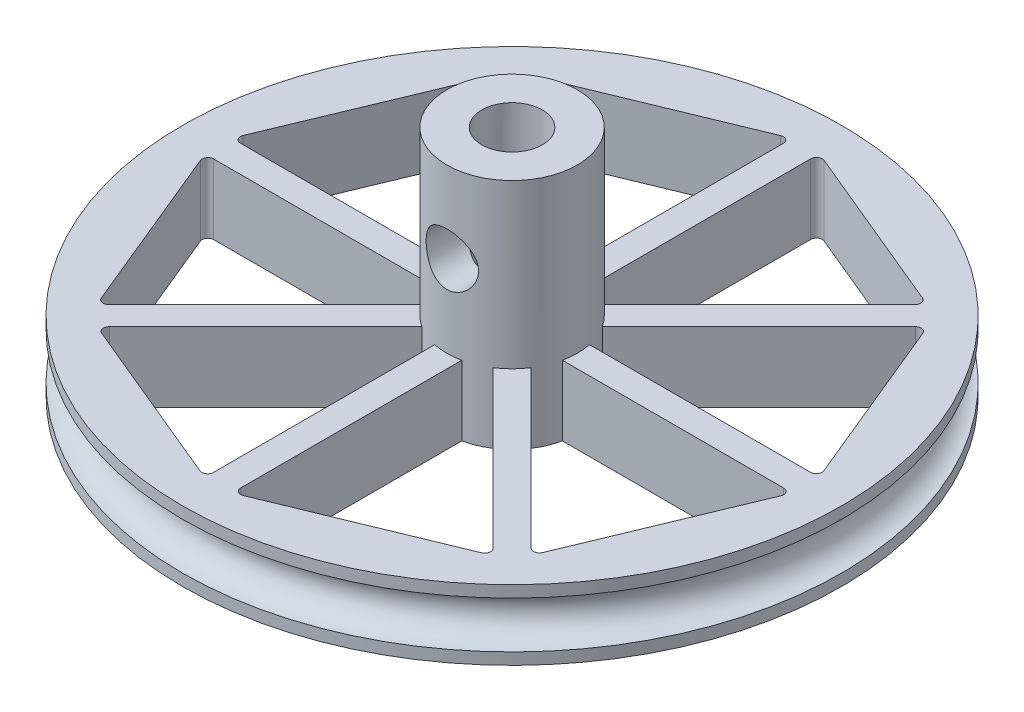
from build123d import *

# Parameters (mm, degrees)
ENL_V_START             = -5.600001354
ENL_V_MAT_EXTRU_1_DEPTH = 11.200001454
ENL_V_MAT_EXTRU_3_DEPTH = 6


# Read off the part's stored shape, not the designer's step: Enlèv. mat.-Extru.1
with BuildPart() as part:
    # Esquisse1 → Révolution1 (revolve)
    with BuildSketch(Plane(origin=(0, 0, 0), x_dir=(0, 0, -1), z_dir=(1, 0, 0)), mode=Mode.PRIVATE) as r_volution1_sk:
        with BuildLine():
            Line((5.6, 0), (28.3, 0))
            Line((28.3, 0), (28.3, -1))
            ThreePointArc((28.3, -1), (26.3, -3), (28.3, -5))
            Line((28.3, -5), (28.3, -6))
            Line((28.3, -6), (2.6, -6))
            Line((2.6, -6), (2.6, 0))
            Line((2.6, 0), (2.6, 14))
            Line((2.6, 14), (5.6, 14))
            Line((5.6, 14), (5.6, 0))
        make_face()
    revolve(r_volution1_sk.sketch.rotate(Axis((0, 0, 0), (0, -1, 0)), 180), axis=Axis((0, 0, 0), (0, -1, 0)))

    # Enlèv. mat.-Extru.1 outline → Enlèv. mat.-Extru.1 (cut)
    with BuildSketch(Plane.XY.offset(ENL_V_START)):
        with BuildLine():
            add(Edge.make_bspline(
                [(0, 4.75), (0.6013076, 4.75), (1.181365788, 4.999070592), (2.001835342, 5.820169976), (2.249317955, 6.403361701), (2.250679092, 7.591483004), (2.003145141, 8.178489261), (1.180171672, 9.002154395), (0.594632574, 9.249370285), (-0.589857498, 9.250627181), (-1.17573609, 9.006205165), (-2.00609398, 8.175925788), (-2.249601609, 7.594858131), (-2.250397379, 6.408159453), (-2.004861685, 5.823479927), (-1.179421259, 4.996843653), (-0.6013076, 4.75), (0, 4.75)],
                knots=[0, 0, 0, 0, 0.125, 0.125, 0.25, 0.25, 0.375, 0.375, 0.5, 0.5, 0.625, 0.625, 0.75, 0.75, 0.875, 0.875, 1, 1, 1, 1], degree=3))
        make_face()
    extrude(amount=ENL_V_MAT_EXTRU_1_DEPTH, mode=Mode.SUBTRACT)

    # Esquisse3 → Enlèv. mat.-Extru.3 (cut)
    with BuildSketch(Plane.XZ.offset(6)):
        with BuildLine():
            Line((-1.161815326, -5.478155269), (-1.161815326, -24.455749626))
            ThreePointArc((-1.161815326, -24.455749626), (-1.383721907, -24.871278266), (-1.852471528, -24.917972746))
            Line((-1.852471528, -24.917972746), (-16.327607753, -18.947318365))
            ThreePointArc((-16.327607753, -18.947318365), (-16.6272717, -18.583004137), (-16.490504941, -18.131541855))
            Line((-16.490504941, -18.131541855), (-3.053336143, -4.694373057))
            ThreePointArc((-3.053336143, -4.694373057), (-2.143701032, -5.173446229), (-1.161815326, -5.478155269))
        make_face()
        with BuildLine():
            Line((-24.481484068, -1.16038833), (-5.478457714, -1.16038833))
            ThreePointArc((-5.478457714, -1.16038833), (-5.174004447, -2.142353374), (-4.695168234, -3.052113244))
            Line((-4.695168234, -3.052113244), (-18.114353895, -16.471298904))
            ThreePointArc((-18.114353895, -16.471298904), (-18.565088662, -16.608210375), (-18.929562681, -16.309772323))
            Line((-18.929562681, -16.309772323), (-24.943139464, -1.852415139))
            ThreePointArc((-24.943139464, -1.852415139), (-24.897424812, -1.382911668), (-24.481484068, -1.16038833))
        make_face()
        with BuildLine():
            Line((-18.131541855, 16.490504941), (-4.694373057, 3.053336143))
            ThreePointArc((-4.694373057, 3.053336143), (-5.173446229, 2.143701032), (-5.478155269, 1.161815326))
            Line((-5.478155269, 1.161815326), (-24.455749626, 1.161815326))
            ThreePointArc((-24.455749626, 1.161815326), (-24.871278266, 1.383721907), (-24.917972746, 1.852471528))
            Line((-24.917972746, 1.852471528), (-18.947318365, 16.327607753))
            ThreePointArc((-18.947318365, 16.327607753), (-18.583004137, 16.6272717), (-18.131541855, 16.490504941))
        make_face()
        with BuildLine():
            Line((-1.16038833, 24.481484068), (-1.16038833, 5.478457714))
            ThreePointArc((-1.16038833, 5.478457714), (-2.142353374, 5.174004447), (-3.052113244, 4.695168234))
            Line((-3.052113244, 4.695168234), (-16.471298904, 18.114353895))
            ThreePointArc((-16.471298904, 18.114353895), (-16.608210375, 18.565088662), (-16.309772323, 18.929562681))
            Line((-16.309772323, 18.929562681), (-1.852415139, 24.943139464))
            ThreePointArc((-1.852415139, 24.943139464), (-1.382911668, 24.897424812), (-1.16038833, 24.481484068))
        make_face()
        with BuildLine():
            Line((16.490504941, 18.131541855), (3.053336143, 4.694373057))
            ThreePointArc((3.053336143, 4.694373057), (2.143701032, 5.173446229), (1.161815326, 5.478155269))
            Line((1.161815326, 5.478155269), (1.161815326, 24.455749626))
            ThreePointArc((1.161815326, 24.455749626), (1.383721907, 24.871278266), (1.852471528, 24.917972746))
            Line((1.852471528, 24.917972746), (16.327607753, 18.947318365))
            ThreePointArc((16.327607753, 18.947318365), (16.6272717, 18.583004137), (16.490504941, 18.131541855))
        make_face()
        with BuildLine():
            Line((24.481484068, 1.16038833), (5.478457714, 1.16038833))
            ThreePointArc((5.478457714, 1.16038833), (5.174004447, 2.142353374), (4.695168234, 3.052113244))
            Line((4.695168234, 3.052113244), (18.114353895, 16.471298904))
            ThreePointArc((18.114353895, 16.471298904), (18.565088662, 16.608210375), (18.929562681, 16.309772323))
            Line((18.929562681, 16.309772323), (24.943139464, 1.852415139))
            ThreePointArc((24.943139464, 1.852415139), (24.897424812, 1.382911668), (24.481484068, 1.16038833))
        make_face()
        with BuildLine():
            Line((18.131541855, -16.490504941), (4.694373057, -3.053336143))
            ThreePointArc((4.694373057, -3.053336143), (5.173446229, -2.143701032), (5.478155269, -1.161815326))
            Line((5.478155269, -1.161815326), (24.455749626, -1.161815326))
            ThreePointArc((24.455749626, -1.161815326), (24.871278266, -1.383721907), (24.917972746, -1.852471528))
            Line((24.917972746, -1.852471528), (18.947318365, -16.327607753))
            ThreePointArc((18.947318365, -16.327607753), (18.583004137, -16.6272717), (18.131541855, -16.490504941))
        make_face()
        with BuildLine():
            Line((1.16038833, -24.481484068), (1.16038833, -5.478457714))
            ThreePointArc((1.16038833, -5.478457714), (2.142353374, -5.174004447), (3.052113244, -4.695168234))
            Line((3.052113244, -4.695168234), (16.471298904, -18.114353895))
            ThreePointArc((16.471298904, -18.114353895), (16.608210375, -18.565088662), (16.309772323, -18.929562681))
            Line((16.309772323, -18.929562681), (1.852415139, -24.943139464))
            ThreePointArc((1.852415139, -24.943139464), (1.382911668, -24.897424812), (1.16038833, -24.481484068))
        make_face()
    extrude(amount=-ENL_V_MAT_EXTRU_3_DEPTH, mode=Mode.SUBTRACT)


solid = part.part
